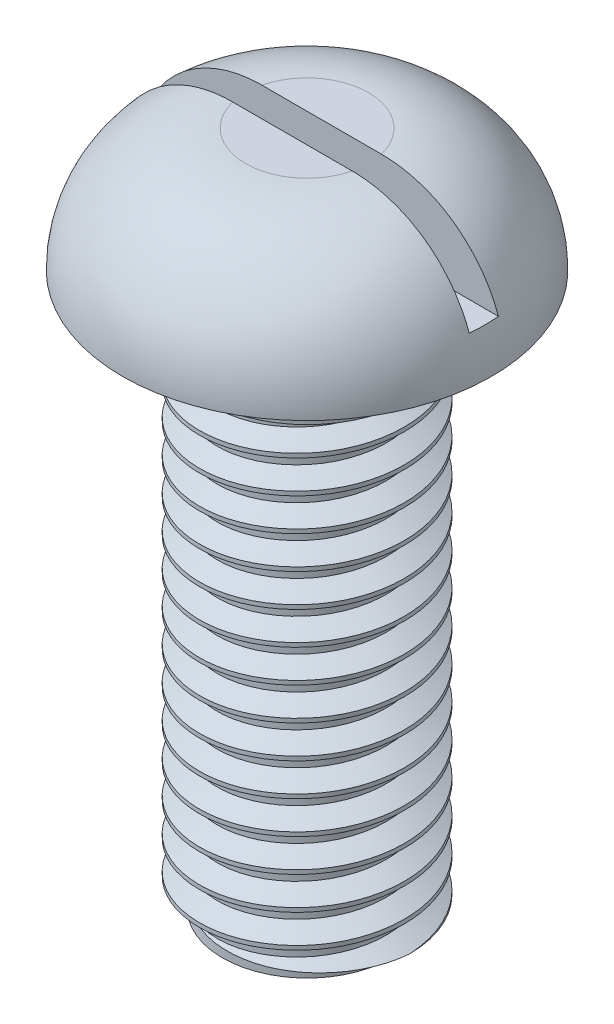
from build123d import *
from build123d.topology import SkipClean

# Parameters (mm, degrees)
SKETCH_1_R          = 2.5
EXTRUDE_2_DEPTH     = 14
SKETCH_3_R          = 4.5
EXTRUDE_3_DEPTH     = 3
FILLET_3_R          = 3
SKETCH_4_W          = 11.333112576
SKETCH_4_H          = 0.71218906
CUT_EXTRUDE_1_DEPTH = 2
THREAD_1_PITCH      = 0.8
SKETCH_11_R         = 2.5
CUT_EXTRUDE_2_DEPTH = 0.5
EXTRUDE_START       = -12
SKETCH_12_R         = 2.5
EXTRUDE_5_DEPTH     = 2
SKETCH_13_R         = 3.021906191
SKETCH_13_R_2       = 2.0669873
CUT_EXTRUDE_3_DEPTH = 0.3


with BuildPart() as part:
    # Sketch 1 → Бобышка-Вытянуть2 (new body)
    with BuildSketch(Plane(origin=(0, 0, 0), x_dir=(1, 0, 0), z_dir=(0, 1, 0))):
        with Locations(Location((0, 0, 0), (0, 0, 270))):
            Circle(SKETCH_1_R)
    extrude(amount=EXTRUDE_2_DEPTH)

    # Эскиз3 → Бобышка-Вытянуть3 (add)
    with BuildSketch(Plane(origin=(0, 14, 0), x_dir=(1, 0, 0), z_dir=(0, 1, 0))):
        with Locations(Location((0, 0, 0), (0, 0, 270))):
            Circle(SKETCH_3_R)
    extrude(amount=EXTRUDE_3_DEPTH)

    # Скругление3
    fillet_3_edges = [part.edges().sort_by_distance(p)[0] for p in [
        (0, 17, -4.5),
    ]]
    fillet(fillet_3_edges, radius=FILLET_3_R - 0.0001)  # a hair under: the kernel refuses the full size

    # Эскиз4 → Вырез-Вытянуть1 (cut)
    with BuildSketch(Plane(origin=(0, 17, 0), x_dir=(1, 0, 0), z_dir=(0, 1, 0))):
        Rectangle(SKETCH_4_W, SKETCH_4_H)
    extrude(amount=-CUT_EXTRUDE_1_DEPTH, mode=Mode.SUBTRACT)

    # Резьба1: the profile of Sketch 1 2 profile screwed along a right-hand helix of 16.25 turns, 8 arcs to a turn; built about Z, then put on its axis
    with SkipClean():  # the faces are left unmerged after this step: merging them gives an invalid solid
        thread_1_z = Axis((0, 0, 0), (0, 0, 1))
        thread_1_corners = [(2.5003, 0, -0.000173205), (2.5003, 0, 0.700173203), (2.0669873, 0, 0.449999999), (2.0669873, 0, 0.249999999)]
        with BuildLine(mode=Mode.PRIVATE) as thread_1_profile:
            Line(thread_1_corners[0], thread_1_corners[1])
            Line(thread_1_corners[1], thread_1_corners[2])
            Line(thread_1_corners[2], thread_1_corners[3])
            Line(thread_1_corners[3], thread_1_corners[0])
        thread_1_cap = Face(thread_1_profile.wire())
        thread_1_turn_angles = [0, 22.5, 45, 67.5, 90, 112.5, 135, 157.5, 180, 202.5, 225, 247.5, 270, 292.5, 315, 337.5, 360]
        thread_1_turn_weights = [1, 0.9238795325112867, 1, 0.9238795325112867, 1, 0.9238795325112867, 1, 0.9238795325112867, 1, 0.9238795325112867, 1, 0.9238795325112867, 1, 0.9238795325112867, 1, 0.9238795325112867, 1]
        thread_1_turn_rails = [Edge.make_bspline([Vector(p[0], p[1], 0).rotate(thread_1_z, thread_1_turn_angles[k]) / thread_1_turn_weights[k] + Vector(0, 0, p[2] + THREAD_1_PITCH * thread_1_turn_angles[k] / 360) for k in range(17)], [0, 0, 0, 1, 1, 2, 2, 3, 3, 4, 4, 5, 5, 6, 6, 7, 7, 8, 8, 8], 2, thread_1_turn_weights) for p in thread_1_corners]
        thread_1_turn_sides = [Face.make_surface_from_curves(thread_1_turn_rails[p[0]], thread_1_turn_rails[p[1]]) for p in [(0, 1), (1, 2), (2, 3), (3, 0)]]
        thread_1_last_angles = [5760, 5782.5, 5805, 5827.5, 5850]
        thread_1_last_weights = [1, 0.9238795325112867, 1, 0.9238795325112867, 1]
        thread_1_last_rails = [Edge.make_bspline([Vector(p[0], p[1], 0).rotate(thread_1_z, thread_1_last_angles[k]) / thread_1_last_weights[k] + Vector(0, 0, p[2] + THREAD_1_PITCH * thread_1_last_angles[k] / 360) for k in range(5)], [0, 0, 0, 1, 1, 2, 2, 2], 2, thread_1_last_weights) for p in thread_1_corners]
        thread_1_last_sides = [Face.make_surface_from_curves(thread_1_last_rails[p[0]], thread_1_last_rails[p[1]]) for p in [(0, 1), (1, 2), (2, 3), (3, 0)]]
        thread_1 = Plane(origin=(0, 0, 0), x_dir=(1, 0, 0), z_dir=(0, 1, 0)) * Solid(Shell([*[p.moved(Location((0, 0, THREAD_1_PITCH * i))) for i in range(16) for p in thread_1_turn_sides], *thread_1_last_sides, thread_1_cap, thread_1_cap.rotate(thread_1_z, 5850).moved(Location((0, 0, THREAD_1_PITCH * 5850 / 360)))]))
        add(thread_1, mode=Mode.SUBTRACT)

    # Эскиз11 → Вырез-Вытянуть2 (cut)
    with BuildSketch(Plane(origin=(0, 0, 0), x_dir=(-1, 0, 0), z_dir=(0, -1, 0))):
        with Locations(Location((0, 0, 0), (0, 0, 90))):
            Circle(SKETCH_11_R)
    extrude(amount=-CUT_EXTRUDE_2_DEPTH, mode=Mode.SUBTRACT)

    # Эскиз12 → Бобышка-Вытянуть5 (add)
    with SkipClean():  # the faces are left unmerged after this step: merging them gives an invalid solid
        with BuildSketch(Plane.XZ.offset(-0.5).offset(EXTRUDE_START)):
            with Locations(Location((0, 0, 0), (0, 0, 90))):
                Circle(SKETCH_12_R)
        extrude(amount=-EXTRUDE_5_DEPTH)

    # Эскиз13 → Вырез-Вытянуть3 (cut)
    with SkipClean():  # the faces are left unmerged after this step: merging them gives an invalid solid
        with BuildSketch(Plane(origin=(0, 0.5, 0), x_dir=(-1, 0, 0), z_dir=(0, -1, 0))):
            Circle(SKETCH_13_R)
            Circle(SKETCH_13_R_2, mode=Mode.SUBTRACT)
        extrude(amount=-CUT_EXTRUDE_3_DEPTH, mode=Mode.SUBTRACT)


solid = part.part
